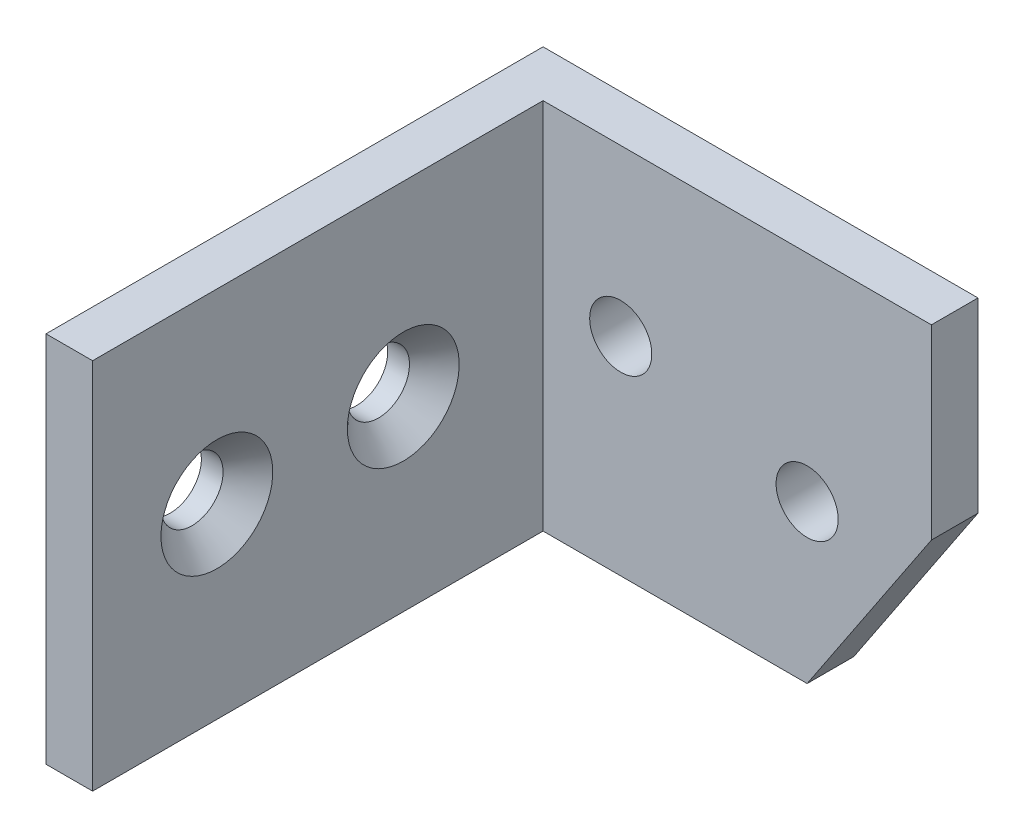
from build123d import *

# Parameters (mm, degrees)
BOSS_EXTRUDE1_DEPTH     = 38.1
CUT_EXTRUDE1_REACH      = 79.512
SKETCH2_R               = 3.175
CUT_EXTRUDE2_REACH      = 79.512
SKETCH4_R               = 3.175
CUT_EXTRUDE3_DEPTH      = 78.51162816
CUT_EXTRUDE3_DEPTH_BACK = 78.51162816
CHAMFER1_SIZE           = 2.54


with BuildPart() as part:
    # Sketch1 → Boss-Extrude1 (new body)
    with BuildSketch(Plane(origin=(0, 0, 0), x_dir=(1, 0, 0), z_dir=(0, 1, 0))):
        Polygon((0, 0), (0, 50.8), (44.45, 50.8), (44.45, 46.0375), (4.7625, 46.0375), (4.7625, 0), align=None)
    extrude(amount=BOSS_EXTRUDE1_DEPTH)

    # Sketch2 → Cut-Extrude1 (cut, up to next)
    with BuildSketch(Plane(origin=(0, 0, -50.8), x_dir=(-1, 0, 0), z_dir=(0, 0, -1)), mode=Mode.PRIVATE) as cut_extrude1_sk1:
        with Locations((-12.7, 21.20738686)):
            Circle(SKETCH2_R)
    cut_extrude1_tool1 = extrude(cut_extrude1_sk1.sketch, amount=-CUT_EXTRUDE1_REACH, mode=Mode.PRIVATE) & part.part
    # Sketch2 → Cut-Extrude1 (cut, up to next)
    with BuildSketch(Plane(origin=(0, 0, -50.8), x_dir=(-1, 0, 0), z_dir=(0, 0, -1)), mode=Mode.PRIVATE) as cut_extrude1_sk2:
        with Locations((-31.75, 16.102954744)):
            Circle(SKETCH2_R)
    cut_extrude1_tool2 = extrude(cut_extrude1_sk2.sketch, amount=-CUT_EXTRUDE1_REACH, mode=Mode.PRIVATE) & part.part
    add(cut_extrude1_tool1.solids().sort_by_distance((12.7, 21.207387, -50.8))[0], mode=Mode.SUBTRACT)
    add(cut_extrude1_tool2.solids().sort_by_distance((31.75, 16.102955, -50.8))[0], mode=Mode.SUBTRACT)

    # Sketch4 → Cut-Extrude2 (cut, up to next)
    with BuildSketch(Plane.ZY, mode=Mode.PRIVATE) as cut_extrude2_sk1:
        with Locations((-12.7, 19.05)):
            Circle(SKETCH4_R)
    cut_extrude2_tool1 = extrude(cut_extrude2_sk1.sketch, amount=-CUT_EXTRUDE2_REACH, mode=Mode.PRIVATE) & part.part
    # Sketch4 → Cut-Extrude2 (cut, up to next)
    with BuildSketch(Plane.ZY, mode=Mode.PRIVATE) as cut_extrude2_sk2:
        with Locations((-31.75, 19.05)):
            Circle(SKETCH4_R)
    cut_extrude2_tool2 = extrude(cut_extrude2_sk2.sketch, amount=-CUT_EXTRUDE2_REACH, mode=Mode.PRIVATE) & part.part
    add(cut_extrude2_tool1.solids().sort_by_distance((0, 19.05, -12.7))[0], mode=Mode.SUBTRACT)
    add(cut_extrude2_tool2.solids().sort_by_distance((0, 19.05, -31.75))[0], mode=Mode.SUBTRACT)

    # Sketch5 → Cut-Extrude3 (cut, two sides: drawn at the far end of the back side and taken through both)
    with BuildSketch(Plane(origin=(0, 0, -50.8), x_dir=(-1, 0, 0), z_dir=(0, 0, -1)).offset(-CUT_EXTRUDE3_DEPTH_BACK)):
        Polygon((28.817809215, -90.851713823), (-31.75, 0), (-44.45, 19.05), (-105.017809215, 109.901713823), (-286.721236861, -11.233904608), (-152.88561843, -211.987332253), align=None)
    extrude(amount=CUT_EXTRUDE3_DEPTH + CUT_EXTRUDE3_DEPTH_BACK, mode=Mode.SUBTRACT)

    # Chamfer1
    chamfer1_edges = [part.edges().sort_by_distance(p)[0] for p in [
        (4.7625, 19.05, -15.875),
        (4.7625, 19.05, -34.925),
    ]]
    chamfer(chamfer1_edges, length=CHAMFER1_SIZE)


solid = part.part
